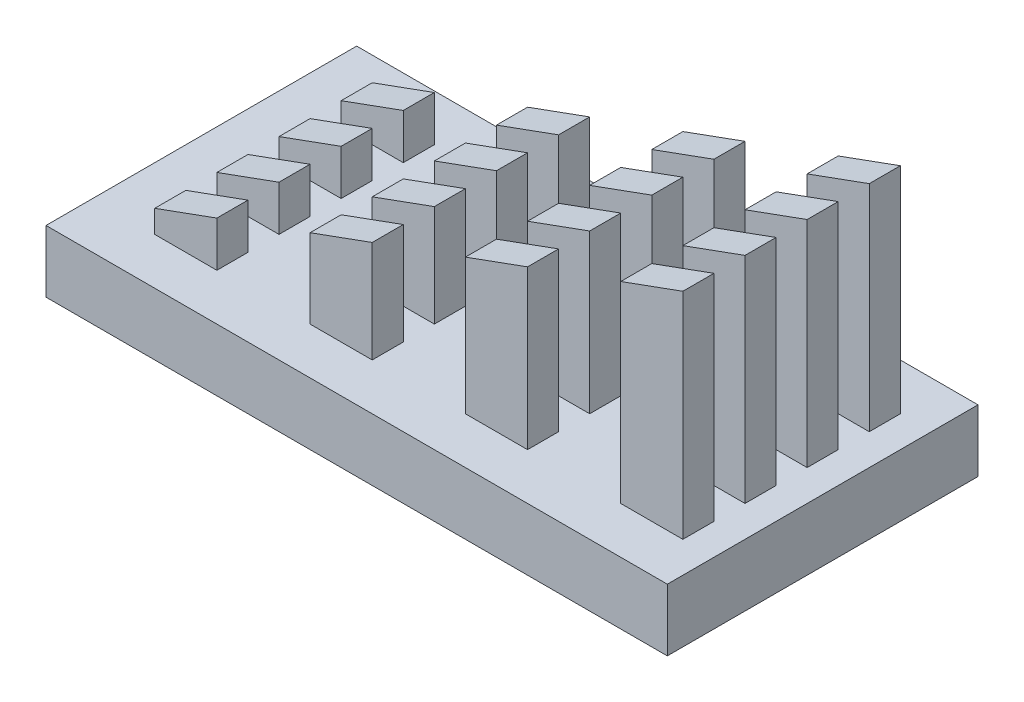
from build123d import *

# Parameters (mm, degrees)
SKETCH_1_W               = 200
SKETCH_1_H               = 20
EXTRUDE_2_DEPTH          = 100
EXTRUDE_3_REACH          = 226.499
SKETCH_3_W               = 20
SKETCH_3_H               = 10
PATTERN_START            = -85
PATTERN_LINEAR_1_DEPTH   = 10
PATTERN_START_2          = -65
PATTERN_LINEAR_1_2_DEPTH = 10
PATTERN_START_3          = -45
PATTERN_LINEAR_1_3_DEPTH = 10
PATTERN_START_4          = -25
PATTERN_LINEAR_1_4_DEPTH = 10


# Read off the part's stored shape, not the designer's step: Линейный массив1
with BuildPart() as part:
    # Эскиз1 → Бобышка-Вытянуть2 (new body)
    with BuildSketch(Plane.XY):
        with Locations((100, 10)):
            Rectangle(SKETCH_1_W, SKETCH_1_H)
    extrude(amount=-EXTRUDE_2_DEPTH)

    # Бобышка-Вытянуть3: up to this plane
    extrude_3_end = Plane(origin=(-6.427876097, 17.660444431, 0), z_dir=(-0.34202014332566943, 0.9396926207859081, 0))
    # Эскиз3 → Бобышка-Вытянуть3 (add, up to the surface)
    with BuildSketch(Plane(origin=(0, 20, 0), x_dir=(1, 0, 0), z_dir=(0, 1, 0)), mode=Mode.PRIVATE) as extrude_3_sk1:
        with Locations((30, 20)):
            Rectangle(SKETCH_3_W, SKETCH_3_H)
    extrude_3_tool1 = split(extrude(extrude_3_sk1.sketch, amount=EXTRUDE_3_REACH, mode=Mode.PRIVATE), bisect_by=extrude_3_end, keep=Keep.BOTH, mode=Mode.PRIVATE)
    add(extrude_3_tool1.solids().sort_by_distance((30, 20, -20))[0])

    # Линейный массив1 outline → Линейный массив1 (add)
    with BuildSketch(Plane.XY.offset(PATTERN_START)):
        Polygon((170, 81.874939825), (170, 20), (190, 20), (190, 89.154344511), align=None)
        Polygon((120, 63.676428112), (120, 20), (140, 20), (140, 70.955832797), align=None)
        Polygon((70, 45.477916399), (70, 20), (90, 20), (90, 52.757321084), align=None)
        Polygon((20, 27.279404685), (20, 20), (40, 20), (40, 34.558809371), align=None)
    extrude(amount=PATTERN_LINEAR_1_DEPTH)

    # Pattern Linear 1 2 outline → Pattern Linear 1 2 (add)
    with BuildSketch(Plane.XY.offset(PATTERN_START_2)):
        Polygon((170, 81.874939825), (170, 20), (190, 20), (190, 89.154344511), align=None)
        Polygon((120, 63.676428112), (120, 20), (140, 20), (140, 70.955832797), align=None)
        Polygon((70, 45.477916399), (70, 20), (90, 20), (90, 52.757321084), align=None)
        Polygon((20, 27.279404685), (20, 20), (40, 20), (40, 34.558809371), align=None)
    extrude(amount=PATTERN_LINEAR_1_2_DEPTH)

    # Pattern Linear 1 3 outline → Pattern Linear 1 3 (add)
    with BuildSketch(Plane.XY.offset(PATTERN_START_3)):
        Polygon((170, 81.874939825), (170, 20), (190, 20), (190, 89.154344511), align=None)
        Polygon((120, 63.676428112), (120, 20), (140, 20), (140, 70.955832797), align=None)
        Polygon((70, 45.477916399), (70, 20), (90, 20), (90, 52.757321084), align=None)
        Polygon((20, 27.279404685), (20, 20), (40, 20), (40, 34.558809371), align=None)
    extrude(amount=PATTERN_LINEAR_1_3_DEPTH)

    # Pattern Linear 1 4 outline → Pattern Linear 1 4 (add)
    with BuildSketch(Plane.XY.offset(PATTERN_START_4)):
        Polygon((170, 81.874939825), (170, 20), (190, 20), (190, 89.154344511), align=None)
        Polygon((120, 63.676428112), (120, 20), (140, 20), (140, 70.955832797), align=None)
        Polygon((70, 45.477916399), (70, 20), (90, 20), (90, 52.757321084), align=None)
    extrude(amount=PATTERN_LINEAR_1_4_DEPTH)


solid = part.part
